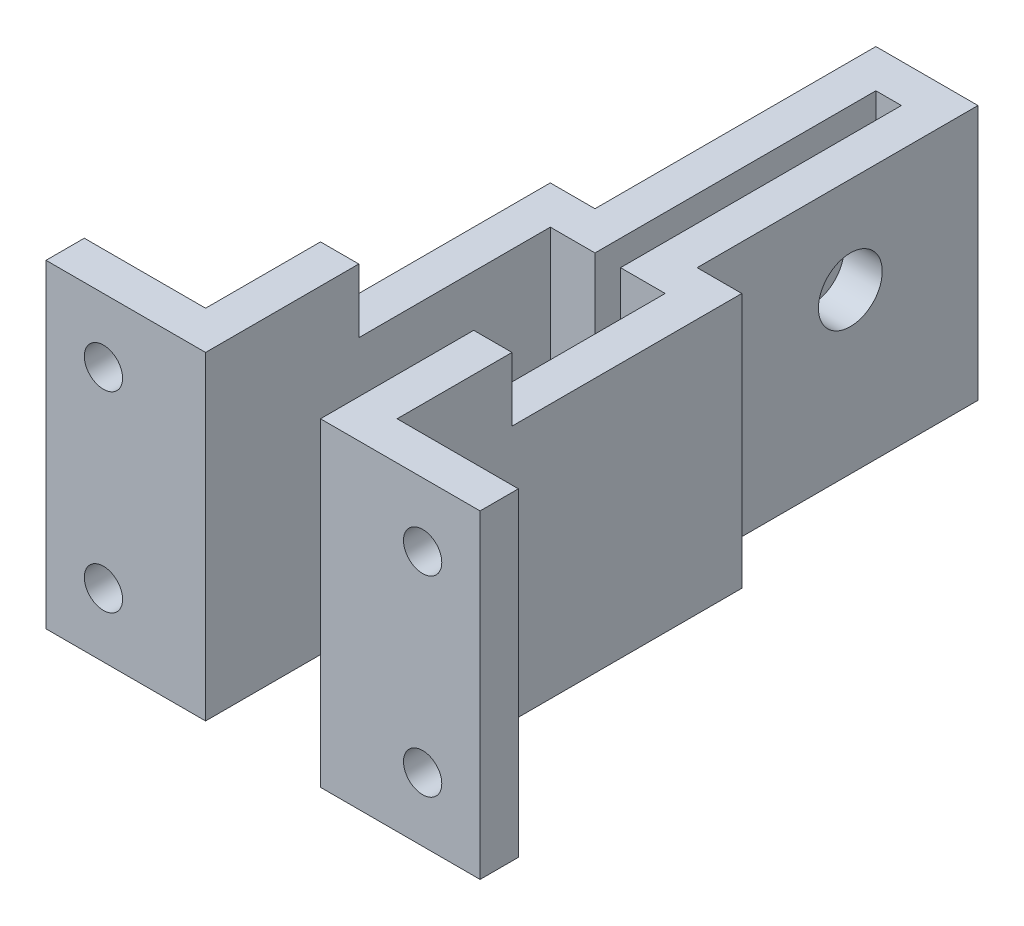
from build123d import *

# Parameters (mm, degrees)
BOSS_EXTRUDE1_DEPTH = 12.5
SKETCH11_R          = 1.5
CUT_EXTRUDE6_DEPTH  = 30
SKETCH12_W          = 40
SKETCH12_H          = 5
CUT_EXTRUDE7_DEPTH  = 15
SKETCH13_R          = 2.5
CUT_EXTRUDE8_DEPTH  = 25


with BuildPart() as part:
    # Sketch9 → Boss-Extrude1 (new, symmetric)
    with BuildSketch(Plane(origin=(0, 0, 0), x_dir=(1, 0, 0), z_dir=(0, 1, 0))):
        Polygon((-17, 0), (-4.5, 0), (-4.5, 27), (-1, 27), (-1, 49), (1, 49), (1, 27), (4.5, 27), (4.5, 0), (17, 0), (17, 3), (7.5, 3), (7.5, 30), (4, 30), (4, 52), (-4, 52), (-4, 30), (-7.5, 30), (-7.5, 3), (-17, 3), align=None)
    extrude(amount=BOSS_EXTRUDE1_DEPTH, both=True)

    # Sketch11 → Cut-Extrude6 (cut)
    with BuildSketch(Plane.XY):
        with Locations((-12.5, 7.5)):
            Circle(SKETCH11_R)
        with Locations((12.5, 7.5)):
            Circle(SKETCH11_R)
        with Locations((12.5, -7.5)):
            Circle(SKETCH11_R)
        with Locations((-12.5, -7.5)):
            Circle(SKETCH11_R)
    extrude(amount=-CUT_EXTRUDE6_DEPTH, mode=Mode.SUBTRACT)

    # Sketch12 → Cut-Extrude7 (cut, symmetric)
    with BuildSketch(Plane(origin=(0, 0, 0), x_dir=(0, 0, -1), z_dir=(1, 0, 0))):
        with Locations((32, 10)):
            Rectangle(SKETCH12_W, SKETCH12_H)
    extrude(amount=CUT_EXTRUDE7_DEPTH, both=True, mode=Mode.SUBTRACT)

    # Sketch13 → Cut-Extrude8 (cut, symmetric)
    with BuildSketch(Plane(origin=(0, 0, 0), x_dir=(0, 0, -1), z_dir=(1, 0, 0))):
        with Locations((42, 0)):
            Circle(SKETCH13_R)
    extrude(amount=CUT_EXTRUDE8_DEPTH, both=True, mode=Mode.SUBTRACT)


solid = part.part
